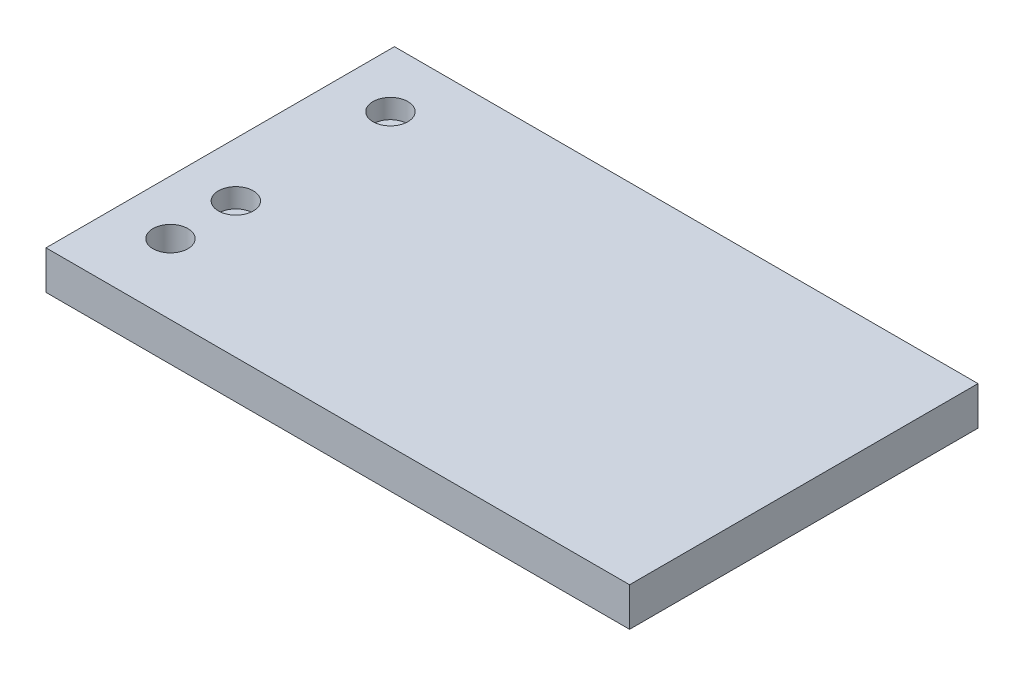
from build123d import *

# Parameters (mm, degrees)
SKETCH1_W           = 151.015799324
SKETCH1_H           = 90.161719468
BOSS_EXTRUDE1_DEPTH = 10
SKETCH2_R           = 4.522511264
CUT_EXTRUDE1_DEPTH  = 10
TPATTERN1_START     = 5
TPATTERN1_OUTLINE_R = 4.522511264
TPATTERN1_DEPTH     = 5


# Read off the part's stored shape, not the designer's step: TPattern1
with BuildPart() as part:
    # Sketch1 → Boss-Extrude1 (new body)
    with BuildSketch(Plane(origin=(0, 0, 0), x_dir=(1, 0, 0), z_dir=(0, 1, 0))):
        with Locations((4.769946885, -6.090262952)):
            Rectangle(SKETCH1_W, SKETCH1_H)
    extrude(amount=BOSS_EXTRUDE1_DEPTH)

    # Sketch2 → Cut-Extrude1 (cut)
    with BuildSketch(Plane(origin=(0, 10, 0), x_dir=(-1, 0, 0), z_dir=(0, 1, 0))):
        with Locations(Location((56.686327356, 33.019898718, 0), (0, 0, 90))):
            Circle(SKETCH2_R)
    extrude(amount=-CUT_EXTRUDE1_DEPTH, mode=Mode.SUBTRACT)

    # TPattern1 outline → TPattern1 (cut)
    with BuildSketch(Plane(origin=(0, 0, 0), x_dir=(1, 0, 0), z_dir=(0, 1, 0)).offset(TPATTERN1_START)):
        with Locations((-56.686327356, -16.090262952)):
            Circle(TPATTERN1_OUTLINE_R)
        with Locations((-56.686327356, 23.909737048)):
            Circle(TPATTERN1_OUTLINE_R)
    extrude(amount=TPATTERN1_DEPTH, mode=Mode.SUBTRACT)


solid = part.part
